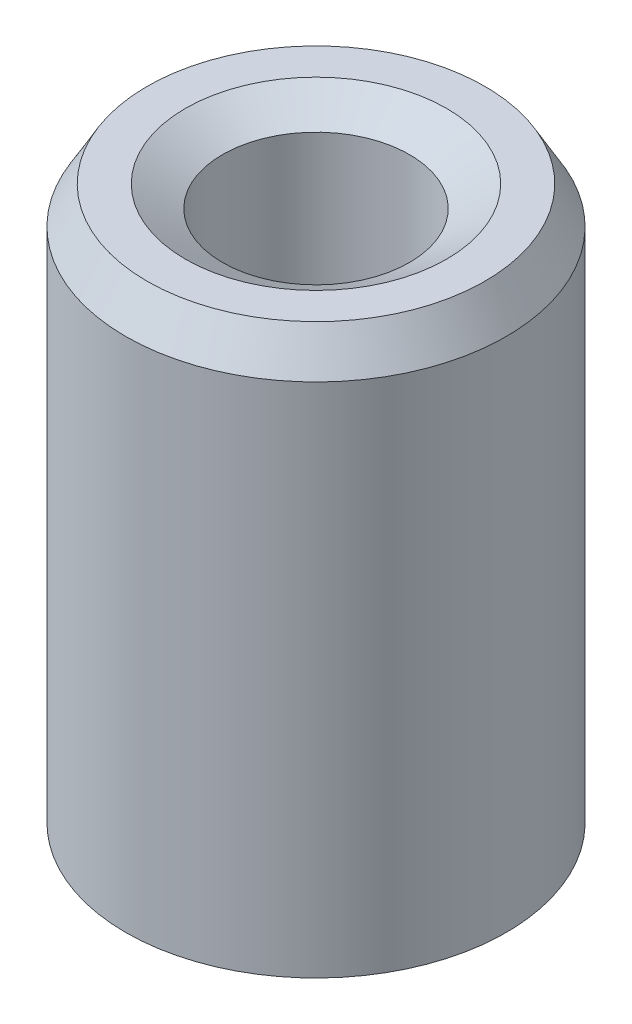
from build123d import *
from OCP.BRepFilletAPI import BRepFilletAPI_MakeChamfer

# Parameters (mm, degrees)
SKETCH1_R           = 5
BOSS_EXTRUDE1_DEPTH = 15.102027665
SKETCH2_R           = 2.457667528
CUT_EXTRUDE1_DEPTH  = 17.675468197
CHAMFER1_SIZE       = 0.974943962
CHAMFER1_SIZE2      = 0.562884159


with BuildPart() as part:
    # Sketch1 → Boss-Extrude1 (new body)
    with BuildSketch(Plane(origin=(0, 0, 0), x_dir=(1, 0, 0), z_dir=(0, 1, 0))):
        Circle(SKETCH1_R)
    extrude(amount=BOSS_EXTRUDE1_DEPTH)

    # Sketch2 → Cut-Extrude1 (cut, through all)
    with BuildSketch(Plane(origin=(0, 0, 0), x_dir=(1, 0, 0), z_dir=(0, 1, 0))):
        Circle(SKETCH2_R)
    extrude(amount=CUT_EXTRUDE1_DEPTH, mode=Mode.SUBTRACT)

    # Chamfer1: one chamfer whose edges measure the first distance from different faces: ONE call of the kernel's chamfer builder (chamfer() names one face for all edges)
    chamfer1_edges_1 = [part.edges().sort_by_distance(p)[0] for p in [
        (-2.457667528, 15.102027665, 0),
    ]]
    chamfer1_side_1 = [part.faces().sort_by_distance(p)[0] for p in [
        (-4.858578644, 15.102027665, 0),
    ]]
    chamfer1_edges_2 = [part.edges().sort_by_distance(p)[0] for p in [
        (-2.457667528, 0, 0),
    ]]
    chamfer1_side_2 = [part.faces().sort_by_distance(p)[0] for p in [
        (-2.457667528, 7.551013832, 0),
    ]]
    chamfer1_edges_3 = [part.edges().sort_by_distance(p)[0] for p in [
        (-5, 0, 0),
    ]]
    chamfer1_side_3 = [part.faces().sort_by_distance(p)[0] for p in [
        (-4.858578644, 0, 0),
    ]]
    chamfer1_edges_4 = [part.edges().sort_by_distance(p)[0] for p in [
        (-5, 15.102027665, 0),
    ]]
    chamfer1_side_4 = [part.faces().sort_by_distance(p)[0] for p in [
        (-5, 7.551013832, 0),
    ]]
    chamfer1 = BRepFilletAPI_MakeChamfer(part.part.solid().wrapped)
    for e in chamfer1_edges_1:
        chamfer1.Add(CHAMFER1_SIZE, CHAMFER1_SIZE2, e.wrapped, chamfer1_side_1[0].wrapped)  # the first distance lies on this face
    for e in chamfer1_edges_2:
        chamfer1.Add(CHAMFER1_SIZE, CHAMFER1_SIZE2, e.wrapped, chamfer1_side_2[0].wrapped)  # the first distance lies on this face
    for e in chamfer1_edges_3:
        chamfer1.Add(CHAMFER1_SIZE, CHAMFER1_SIZE2, e.wrapped, chamfer1_side_3[0].wrapped)  # the first distance lies on this face
    for e in chamfer1_edges_4:
        chamfer1.Add(CHAMFER1_SIZE, CHAMFER1_SIZE2, e.wrapped, chamfer1_side_4[0].wrapped)  # the first distance lies on this face
    add(Compound.cast(chamfer1.Shape()), mode=Mode.REPLACE)


solid = part.part
